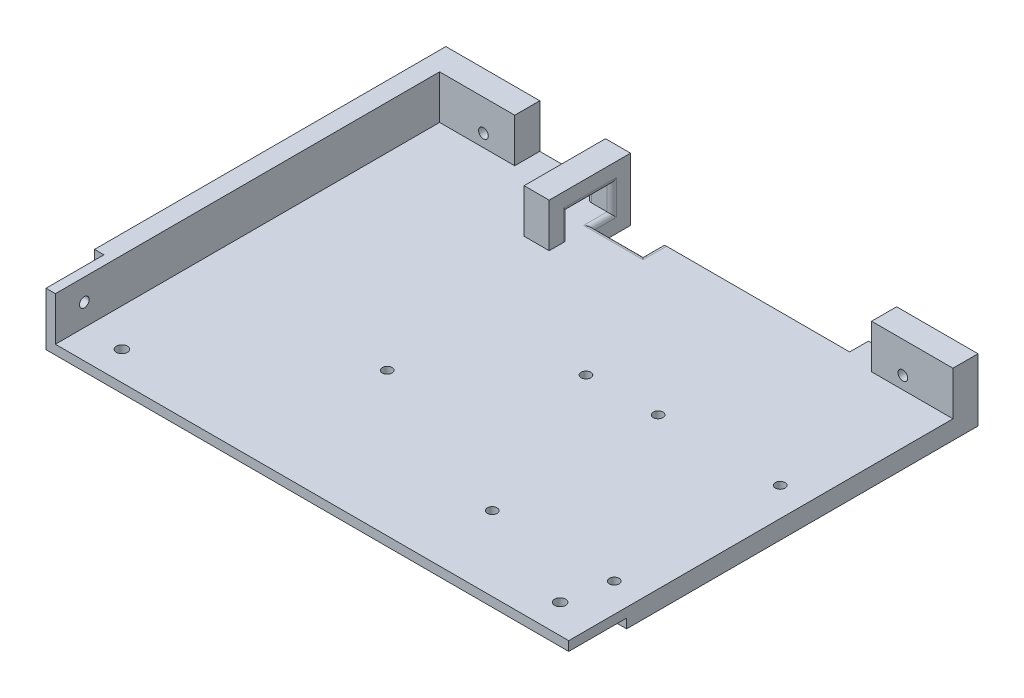
from build123d import *

# Parameters (mm, degrees)
BOSS_EXTRUDE1_DEPTH = 6
SKETCH2_W           = 30
SKETCH2_H           = 8
SKETCH2_W_2         = 26
BOSS_EXTRUDE2_DEPTH = 14
SKETCH3_R           = 1.55
CUT_EXTRUDE1_DEPTH  = 151.6405075
SKETCH4_W           = 170
SKETCH4_H           = 18.5
CUT_EXTRUDE2_DEPTH  = 3
SKETCH5_R           = 1.75
CUT_EXTRUDE3_DEPTH  = 3
BOSS_EXTRUDE3_REACH = 111.082
CUT_EXTRUDE4_REACH  = 110.143
SKETCH8_W           = 3
SKETCH8_H           = 18.5
SKETCH9_R           = 1.55
CUT_EXTRUDE5_DEPTH  = 10
CUT_EXTRUDE6_REACH  = 110.143
SKETCH10_W          = 16
SKETCH10_H          = 12
SKETCH11_W          = 8
SKETCH11_H          = 26
BOSS_EXTRUDE4_DEPTH = 14
CUT_EXTRUDE7_REACH  = 132.364
FILLET1_R           = 1.5
CUT_EXTRUDE8_REACH  = 110.143
SKETCH15_R          = 1.55


with BuildPart() as part:
    # Sketch1 → Boss-Extrude1 (new body)
    with BuildSketch(Plane(origin=(0, 0, 0), x_dir=(1, 0, 0), z_dir=(0, 1, 0))):
        Polygon((-85, 65.375), (-85, -65.375), (85, -65.375), (85, 65.375), (50, 65.375), (50, 59.375), (-10, 59.375), (-10, 65.375), align=None)
    extrude(amount=BOSS_EXTRUDE1_DEPTH)

    # Sketch2 → Boss-Extrude2 (add)
    with BuildSketch(Plane(origin=(0, 6, 0), x_dir=(1, 0, 0), z_dir=(0, 1, 0))):
        with Locations((-70, 61.375)):
            Rectangle(SKETCH2_W, SKETCH2_H)
        with Locations((72, 61.375)):
            Rectangle(SKETCH2_W_2, SKETCH2_H)
    extrude(amount=BOSS_EXTRUDE2_DEPTH)

    # Sketch3 → Cut-Extrude1 (cut, through all)
    with BuildSketch(Plane.XY.offset(-57.375)):
        with Locations((-65, 10)):
            Circle(SKETCH3_R)
        with Locations((69, 10)):
            Circle(SKETCH3_R)
    extrude(amount=-CUT_EXTRUDE1_DEPTH, mode=Mode.SUBTRACT)

    # Sketch4 → Cut-Extrude2 (cut)
    with BuildSketch(Plane(origin=(0, 0, 0), x_dir=(1, 0, 0), z_dir=(0, 1, 0))):
        with Locations((0, -56.125)):
            Rectangle(SKETCH4_W, SKETCH4_H)
    extrude(amount=CUT_EXTRUDE2_DEPTH, mode=Mode.SUBTRACT)

    # Sketch5 → Cut-Extrude3 (cut)
    with BuildSketch(Plane(origin=(0, 3, 0), x_dir=(-1, 0, 0), z_dir=(0, -1, 0))):
        with Locations(Location((67, -56.125, 0), (0, 0, 90))):
            Circle(SKETCH5_R)
        with Locations(Location((-73, -56.125, 0), (0, 0, 90))):
            Circle(SKETCH5_R)
    extrude(amount=-CUT_EXTRUDE3_DEPTH, mode=Mode.SUBTRACT)

    # Sketch7 → Boss-Extrude3 (add, up to next)
    with BuildSketch(Plane(origin=(0, 20, 0), x_dir=(1, 0, 0), z_dir=(0, 1, 0)), mode=Mode.PRIVATE) as boss_extrude3_sk1:
        Polygon((-79, 65.375), (-85, 65.375), (-85, -46.875), (-82, -46.875), (-82, -65.375), (-79, -65.375), align=None)
    boss_extrude3_tool1 = extrude(boss_extrude3_sk1.sketch, amount=-BOSS_EXTRUDE3_REACH, mode=Mode.PRIVATE) - part.part
    add(boss_extrude3_tool1.solids().sort_by_distance((-81.885802, 20, -4.272891))[0])

    # Sketch8 → Cut-Extrude4 (cut, up to next)
    with BuildSketch(Plane(origin=(0, 6, 0), x_dir=(1, 0, 0), z_dir=(0, 1, 0)), mode=Mode.PRIVATE) as cut_extrude4_sk1:
        with Locations((-83.5, -56.125)):
            Rectangle(SKETCH8_W, SKETCH8_H)
    cut_extrude4_tool1 = extrude(cut_extrude4_sk1.sketch, amount=-CUT_EXTRUDE4_REACH, mode=Mode.PRIVATE) & part.part
    add(cut_extrude4_tool1.solids().sort_by_distance((-83.5, 6, 56.125))[0], mode=Mode.SUBTRACT)

    # Sketch9 → Cut-Extrude5 (cut)
    with BuildSketch(Plane(origin=(-79, 0, 0), x_dir=(0, 0, -1), z_dir=(1, 0, 0))):
        with Locations((-56.125, 13)):
            Circle(SKETCH9_R)
    extrude(amount=-CUT_EXTRUDE5_DEPTH, mode=Mode.SUBTRACT)

    # Sketch10 → Cut-Extrude6 (cut, up to next)
    with BuildSketch(Plane(origin=(0, 6, 0), x_dir=(1, 0, 0), z_dir=(0, 1, 0)), mode=Mode.PRIVATE) as cut_extrude6_sk1:
        with Locations((-18, 59.375)):
            Rectangle(SKETCH10_W, SKETCH10_H)
    cut_extrude6_tool1 = extrude(cut_extrude6_sk1.sketch, amount=-CUT_EXTRUDE6_REACH, mode=Mode.PRIVATE) & part.part
    add(cut_extrude6_tool1.solids().sort_by_distance((-18, 6, -59.375))[0], mode=Mode.SUBTRACT)

    # Sketch11 → Boss-Extrude4 (add)
    with BuildSketch(Plane(origin=(0, 6, 0), x_dir=(1, 0, 0), z_dir=(0, 1, 0))):
        with Locations((-30, 52.375)):
            Rectangle(SKETCH11_W, SKETCH11_H)
    extrude(amount=BOSS_EXTRUDE4_DEPTH)

    # Sketch13 → Cut-Extrude7 (cut, up to next)
    with BuildSketch(Plane(origin=(-26, 0, 0), x_dir=(0, 0, -1), z_dir=(1, 0, 0)), mode=Mode.PRIVATE) as cut_extrude7_sk1:
        Polygon((45.375, 12), (45.375, 6), (59.375, 6), (59.375, 12), (59.375, 14), (45.375, 14), align=None)
    cut_extrude7_tool1 = extrude(cut_extrude7_sk1.sketch, amount=-CUT_EXTRUDE7_REACH, mode=Mode.PRIVATE) & part.part
    add(cut_extrude7_tool1.solids().sort_by_distance((-26, 10, -52.375))[0], mode=Mode.SUBTRACT)

    # Fillet1
    # the kernel refuses this fillet: 1.5 mm, written as the material it takes off along each edge
    with BuildSketch(Plane(origin=(-34, 6, -59.375), x_dir=(0, 0, -1), z_dir=(0, 1, 0)), Plane(origin=(-26, 14, -59.375), x_dir=(0, 0, -1), z_dir=(0, -1, 0)), Plane(origin=(-34, 14, -45.375), x_dir=(0, 0, 1), z_dir=(0, -1, 0)), Plane(origin=(-26, 6, -45.375), x_dir=(0, 0, 1), z_dir=(0, 1, 0))) as fillet1_piece_1:
        with BuildLine():
            CenterArc((FILLET1_R, -FILLET1_R), FILLET1_R, 90, 90)
            Line((0, -FILLET1_R), (0, 0))
            Line((0, 0), (FILLET1_R, 0))
        make_face()
    extrude(amount=8, mode=Mode.SUBTRACT)
    with BuildSketch(Plane(origin=(-34, 14, -59.375), x_dir=(0, 1, 0), z_dir=(0, 0, 1))) as fillet1_piece_2:
        with BuildLine():
            CenterArc((FILLET1_R, -FILLET1_R), FILLET1_R, 90, 90)
            Line((0, -FILLET1_R), (0, 0))
            Line((0, 0), (FILLET1_R, 0))
        make_face()
    extrude(amount=14, mode=Mode.SUBTRACT)
    with BuildSketch(Plane(origin=(-26, 14, -59.375), x_dir=(0, 1, 0), z_dir=(0, 0, 1))) as fillet1_piece_3:
        with BuildLine():
            CenterArc((FILLET1_R, FILLET1_R), FILLET1_R, 180, 90)
            Line((0, FILLET1_R), (0, 0))
            Line((0, 0), (FILLET1_R, 0))
        make_face()
    extrude(amount=14, mode=Mode.SUBTRACT)
    with BuildSketch(Plane(origin=(-10, 6, -53.375), x_dir=(1, 0, 0), z_dir=(0, 0, -1))) as fillet1_piece_4:
        with BuildLine():
            CenterArc((FILLET1_R, FILLET1_R), FILLET1_R, 180, 90)
            Line((0, FILLET1_R), (0, 0))
            Line((0, 0), (FILLET1_R, 0))
        make_face()
    extrude(amount=9.75, mode=Mode.SUBTRACT)
    with BuildSketch(Plane(origin=(-26, 6, -59.375), x_dir=(0, -1, 0), z_dir=(0, 0, 1))) as fillet1_piece_5:
        with BuildLine():
            CenterArc((FILLET1_R, -FILLET1_R), FILLET1_R, 90, 90)
            Line((0, -FILLET1_R), (0, 0))
            Line((0, 0), (FILLET1_R, 0))
        make_face()
    extrude(amount=6, mode=Mode.SUBTRACT)
    with BuildSketch(Plane(origin=(-26, 6, -53.375), x_dir=(0, 0, 1), z_dir=(1, 0, 0))) as fillet1_piece_6:
        with BuildLine():
            CenterArc((FILLET1_R, FILLET1_R), FILLET1_R, 180, 90)
            Line((0, FILLET1_R), (0, 0))
            Line((0, 0), (FILLET1_R, 0))
        make_face()
    extrude(amount=16, mode=Mode.SUBTRACT)
    with BuildSketch(Plane(origin=(-34, 14, -63.125), x_dir=(0, 1, 0), z_dir=(0, 0, 1))) as fillet1_piece_7a_section:
        with BuildLine():
            CenterArc((FILLET1_R, -FILLET1_R), FILLET1_R, 90, 90)
            Line((0, -FILLET1_R), (0, 0))
            Line((0, 0), (FILLET1_R, 0))
        make_face()
    fillet1_piece_7a = extrude(amount=17.75, mode=Mode.PRIVATE)
    fillet1_piece_7a = split(fillet1_piece_7a, bisect_by=Plane(origin=(-33.660407329, 14.339592671, -59.375), z_dir=(0, 0, -1)), keep=Keep.TOP, mode=Mode.PRIVATE)
    with BuildSketch(Plane(origin=(-34, 6, -59.375), x_dir=(0, 0, -1), z_dir=(0, 1, 0))) as fillet1_piece_7b_section:
        with BuildLine():
            CenterArc((FILLET1_R, -FILLET1_R), FILLET1_R, 90, 90)
            Line((0, -FILLET1_R), (0, 0))
            Line((0, 0), (FILLET1_R, 0))
        make_face()
    fillet1_piece_7b = extrude(amount=11.75, mode=Mode.PRIVATE)
    fillet1_piece_7b = split(fillet1_piece_7b, bisect_by=Plane(origin=(-33.660407329, 14, -59.714592671), z_dir=(0, 1, 0)), keep=Keep.TOP, mode=Mode.PRIVATE)
    fillet1_piece_7 = fillet1_piece_7a & fillet1_piece_7b
    add(fillet1_piece_7, mode=Mode.SUBTRACT)
    with BuildSketch(Plane(origin=(-26, 14, -63.125), x_dir=(0, 1, 0), z_dir=(0, 0, 1))) as fillet1_piece_8a_section:
        with BuildLine():
            CenterArc((FILLET1_R, FILLET1_R), FILLET1_R, 180, 90)
            Line((0, FILLET1_R), (0, 0))
            Line((0, 0), (FILLET1_R, 0))
        make_face()
    fillet1_piece_8a = extrude(amount=17.75, mode=Mode.PRIVATE)
    fillet1_piece_8a = split(fillet1_piece_8a, bisect_by=Plane(origin=(-26.339592671, 14.339592671, -59.375), z_dir=(0, 0, -1)), keep=Keep.TOP, mode=Mode.PRIVATE)
    with BuildSketch(Plane(origin=(-26, 17.75, -59.375), x_dir=(0, 0, -1), z_dir=(0, -1, 0))) as fillet1_piece_8b_section:
        with BuildLine():
            CenterArc((FILLET1_R, -FILLET1_R), FILLET1_R, 90, 90)
            Line((0, -FILLET1_R), (0, 0))
            Line((0, 0), (FILLET1_R, 0))
        make_face()
    fillet1_piece_8b = extrude(amount=11.75, mode=Mode.PRIVATE)
    fillet1_piece_8b = split(fillet1_piece_8b, bisect_by=Plane(origin=(-26.339592671, 14, -59.714592671), z_dir=(0, 1, 0)), keep=Keep.TOP, mode=Mode.PRIVATE)
    fillet1_piece_8 = fillet1_piece_8a & fillet1_piece_8b
    add(fillet1_piece_8, mode=Mode.SUBTRACT)
    with BuildSketch(Plane(origin=(-26, 14, -59.375), x_dir=(0, 0, -1), z_dir=(0, -1, 0))) as fillet1_piece_9a_section:
        with BuildLine():
            CenterArc((FILLET1_R, -FILLET1_R), FILLET1_R, 90, 90)
            Line((0, -FILLET1_R), (0, 0))
            Line((0, 0), (FILLET1_R, 0))
        make_face()
    fillet1_piece_9a = extrude(amount=11.75, mode=Mode.PRIVATE)
    fillet1_piece_9a = split(fillet1_piece_9a, bisect_by=Plane(origin=(-26.339592671, 6, -59.714592671), z_dir=(0, -1, 0)), keep=Keep.TOP, mode=Mode.PRIVATE)
    with BuildSketch(Plane(origin=(-26, 6, -63.125), x_dir=(0, -1, 0), z_dir=(0, 0, 1))) as fillet1_piece_9b_section:
        with BuildLine():
            CenterArc((FILLET1_R, -FILLET1_R), FILLET1_R, 90, 90)
            Line((0, -FILLET1_R), (0, 0))
            Line((0, 0), (FILLET1_R, 0))
        make_face()
    fillet1_piece_9b = extrude(amount=9.75, mode=Mode.PRIVATE)
    fillet1_piece_9b = split(fillet1_piece_9b, bisect_by=Plane(origin=(-26.339592671, 5.660407329, -59.375), z_dir=(0, 0, -1)), keep=Keep.TOP, mode=Mode.PRIVATE)
    fillet1_piece_9 = fillet1_piece_9a & fillet1_piece_9b
    add(fillet1_piece_9, mode=Mode.SUBTRACT)
    with BuildSketch(Plane(origin=(-34, 17.75, -45.375), x_dir=(0, 0, 1), z_dir=(0, -1, 0))) as fillet1_piece_10a_section:
        with BuildLine():
            CenterArc((FILLET1_R, -FILLET1_R), FILLET1_R, 90, 90)
            Line((0, -FILLET1_R), (0, 0))
            Line((0, 0), (FILLET1_R, 0))
        make_face()
    fillet1_piece_10a = extrude(amount=11.75, mode=Mode.PRIVATE)
    fillet1_piece_10a = split(fillet1_piece_10a, bisect_by=Plane(origin=(-33.660407329, 14, -45.035407329), z_dir=(0, 1, 0)), keep=Keep.TOP, mode=Mode.PRIVATE)
    with BuildSketch(Plane(origin=(-34, 14, -59.375), x_dir=(0, 1, 0), z_dir=(0, 0, 1))) as fillet1_piece_10b_section:
        with BuildLine():
            CenterArc((FILLET1_R, -FILLET1_R), FILLET1_R, 90, 90)
            Line((0, -FILLET1_R), (0, 0))
            Line((0, 0), (FILLET1_R, 0))
        make_face()
    fillet1_piece_10b = extrude(amount=17.75, mode=Mode.PRIVATE)
    fillet1_piece_10b = split(fillet1_piece_10b, bisect_by=Plane(origin=(-33.660407329, 14.339592671, -45.375), z_dir=(0, 0, 1)), keep=Keep.TOP, mode=Mode.PRIVATE)
    fillet1_piece_10 = fillet1_piece_10a & fillet1_piece_10b
    add(fillet1_piece_10, mode=Mode.SUBTRACT)
    with BuildSketch(Plane(origin=(-26, 6, -45.375), x_dir=(0, 0, 1), z_dir=(0, 1, 0))) as fillet1_piece_11a_section:
        with BuildLine():
            CenterArc((FILLET1_R, -FILLET1_R), FILLET1_R, 90, 90)
            Line((0, -FILLET1_R), (0, 0))
            Line((0, 0), (FILLET1_R, 0))
        make_face()
    fillet1_piece_11a = extrude(amount=11.75, mode=Mode.PRIVATE)
    fillet1_piece_11a = split(fillet1_piece_11a, bisect_by=Plane(origin=(-26.339592671, 14, -45.035407329), z_dir=(0, 1, 0)), keep=Keep.TOP, mode=Mode.PRIVATE)
    with BuildSketch(Plane(origin=(-26, 14, -59.375), x_dir=(0, 1, 0), z_dir=(0, 0, 1))) as fillet1_piece_11b_section:
        with BuildLine():
            CenterArc((FILLET1_R, FILLET1_R), FILLET1_R, 180, 90)
            Line((0, FILLET1_R), (0, 0))
            Line((0, 0), (FILLET1_R, 0))
        make_face()
    fillet1_piece_11b = extrude(amount=17.75, mode=Mode.PRIVATE)
    fillet1_piece_11b = split(fillet1_piece_11b, bisect_by=Plane(origin=(-26.339592671, 14.339592671, -45.375), z_dir=(0, 0, 1)), keep=Keep.TOP, mode=Mode.PRIVATE)
    fillet1_piece_11 = fillet1_piece_11a & fillet1_piece_11b
    add(fillet1_piece_11, mode=Mode.SUBTRACT)
    with BuildSketch(Plane(origin=(-10, 6, -49.625), x_dir=(1, 0, 0), z_dir=(0, 0, -1))) as fillet1_piece_12a_section:
        with BuildLine():
            CenterArc((FILLET1_R, FILLET1_R), FILLET1_R, 180, 90)
            Line((0, FILLET1_R), (0, 0))
            Line((0, 0), (FILLET1_R, 0))
        make_face()
    fillet1_piece_12a = extrude(amount=13.5, mode=Mode.PRIVATE)
    fillet1_piece_12a = split(fillet1_piece_12a, bisect_by=Plane(origin=(-9.660407329, 5.660407329, -53.375), z_dir=(0, 0, 1)), keep=Keep.TOP, mode=Mode.PRIVATE)
    with BuildSketch(Plane(origin=(-26, 6, -53.375), x_dir=(0, 0, 1), z_dir=(1, 0, 0))) as fillet1_piece_12b_section:
        with BuildLine():
            CenterArc((FILLET1_R, FILLET1_R), FILLET1_R, 180, 90)
            Line((0, FILLET1_R), (0, 0))
            Line((0, 0), (FILLET1_R, 0))
        make_face()
    fillet1_piece_12b = extrude(amount=19.75, mode=Mode.PRIVATE)
    fillet1_piece_12b = split(fillet1_piece_12b, bisect_by=Plane(origin=(-10, 5.660407329, -53.035407329), z_dir=(1, 0, 0)), keep=Keep.TOP, mode=Mode.PRIVATE)
    fillet1_piece_12 = fillet1_piece_12a & fillet1_piece_12b
    add(fillet1_piece_12, mode=Mode.SUBTRACT)
    with BuildSketch(Plane(origin=(-26, 6, -59.375), x_dir=(0, -1, 0), z_dir=(0, 0, 1))) as fillet1_piece_13a_section:
        with BuildLine():
            CenterArc((FILLET1_R, -FILLET1_R), FILLET1_R, 90, 90)
            Line((0, -FILLET1_R), (0, 0))
            Line((0, 0), (FILLET1_R, 0))
        make_face()
    fillet1_piece_13a = extrude(amount=9.75, mode=Mode.PRIVATE)
    fillet1_piece_13a = split(fillet1_piece_13a, bisect_by=Plane(origin=(-26.339592671, 5.660407329, -53.375), z_dir=(0, 0, 1)), keep=Keep.TOP, mode=Mode.PRIVATE)
    with BuildSketch(Plane(origin=(-29.75, 6, -53.375), x_dir=(0, 0, 1), z_dir=(1, 0, 0))) as fillet1_piece_13b_section:
        with BuildLine():
            CenterArc((FILLET1_R, FILLET1_R), FILLET1_R, 180, 90)
            Line((0, FILLET1_R), (0, 0))
            Line((0, 0), (FILLET1_R, 0))
        make_face()
    fillet1_piece_13b = extrude(amount=19.75, mode=Mode.PRIVATE)
    fillet1_piece_13b = split(fillet1_piece_13b, bisect_by=Plane(origin=(-26, 5.660407329, -53.035407329), z_dir=(-1, 0, 0)), keep=Keep.TOP, mode=Mode.PRIVATE)
    fillet1_piece_13 = fillet1_piece_13a & fillet1_piece_13b
    add(fillet1_piece_13, mode=Mode.SUBTRACT)

    # Sketch15 → Cut-Extrude8 (cut, up to next)
    with BuildSketch(Plane(origin=(0, 6, 0), x_dir=(1, 0, 0), z_dir=(0, 1, 0)), mode=Mode.PRIVATE) as cut_extrude8_sk1:
        with Locations(Location((-18.8, -19.575, 0), (0, 0, 270))):
            Circle(SKETCH15_R)
    cut_extrude8_tool1 = extrude(cut_extrude8_sk1.sketch, amount=-CUT_EXTRUDE8_REACH, mode=Mode.PRIVATE) & part.part
    # Sketch15 → Cut-Extrude8 (cut, up to next)
    with BuildSketch(Plane(origin=(0, 6, 0), x_dir=(1, 0, 0), z_dir=(0, 1, 0)), mode=Mode.PRIVATE) as cut_extrude8_sk2:
        with Locations(Location((14.26, 10.875, 0), (0, 0, 270))):
            Circle(SKETCH15_R)
    cut_extrude8_tool2 = extrude(cut_extrude8_sk2.sketch, amount=-CUT_EXTRUDE8_REACH, mode=Mode.PRIVATE) & part.part
    # Sketch15 → Cut-Extrude8 (cut, up to next)
    with BuildSketch(Plane(origin=(0, 6, 0), x_dir=(1, 0, 0), z_dir=(0, 1, 0)), mode=Mode.PRIVATE) as cut_extrude8_sk3:
        with Locations(Location((36.8, 11.375, 0), (0, 0, 270))):
            Circle(SKETCH15_R)
    cut_extrude8_tool3 = extrude(cut_extrude8_sk3.sketch, amount=-CUT_EXTRUDE8_REACH, mode=Mode.PRIVATE) & part.part
    # Sketch15 → Cut-Extrude8 (cut, up to next)
    with BuildSketch(Plane(origin=(0, 6, 0), x_dir=(1, 0, 0), z_dir=(0, 1, 0)), mode=Mode.PRIVATE) as cut_extrude8_sk4:
        with Locations(Location((75.8, 11.375, 0), (0, 0, 270))):
            Circle(SKETCH15_R)
    cut_extrude8_tool4 = extrude(cut_extrude8_sk4.sketch, amount=-CUT_EXTRUDE8_REACH, mode=Mode.PRIVATE) & part.part
    # Sketch15 → Cut-Extrude8 (cut, up to next)
    with BuildSketch(Plane(origin=(0, 6, 0), x_dir=(1, 0, 0), z_dir=(0, 1, 0)), mode=Mode.PRIVATE) as cut_extrude8_sk5:
        with Locations(Location((75.8, -41.625, 0), (0, 0, 270))):
            Circle(SKETCH15_R)
    cut_extrude8_tool5 = extrude(cut_extrude8_sk5.sketch, amount=-CUT_EXTRUDE8_REACH, mode=Mode.PRIVATE) & part.part
    # Sketch15 → Cut-Extrude8 (cut, up to next)
    with BuildSketch(Plane(origin=(0, 6, 0), x_dir=(1, 0, 0), z_dir=(0, 1, 0)), mode=Mode.PRIVATE) as cut_extrude8_sk6:
        with Locations(Location((36.8, -41.625, 0), (0, 0, 270))):
            Circle(SKETCH15_R)
    cut_extrude8_tool6 = extrude(cut_extrude8_sk6.sketch, amount=-CUT_EXTRUDE8_REACH, mode=Mode.PRIVATE) & part.part
    add(cut_extrude8_tool1.solids().sort_by_distance((-18.8, 6, 19.575))[0], mode=Mode.SUBTRACT)
    add(cut_extrude8_tool2.solids().sort_by_distance((14.26, 6, -10.875))[0], mode=Mode.SUBTRACT)
    add(cut_extrude8_tool3.solids().sort_by_distance((36.8, 6, -11.375))[0], mode=Mode.SUBTRACT)
    add(cut_extrude8_tool4.solids().sort_by_distance((75.8, 6, -11.375))[0], mode=Mode.SUBTRACT)
    add(cut_extrude8_tool5.solids().sort_by_distance((75.8, 6, 41.625))[0], mode=Mode.SUBTRACT)
    add(cut_extrude8_tool6.solids().sort_by_distance((36.8, 6, 41.625))[0], mode=Mode.SUBTRACT)


solid = part.part
